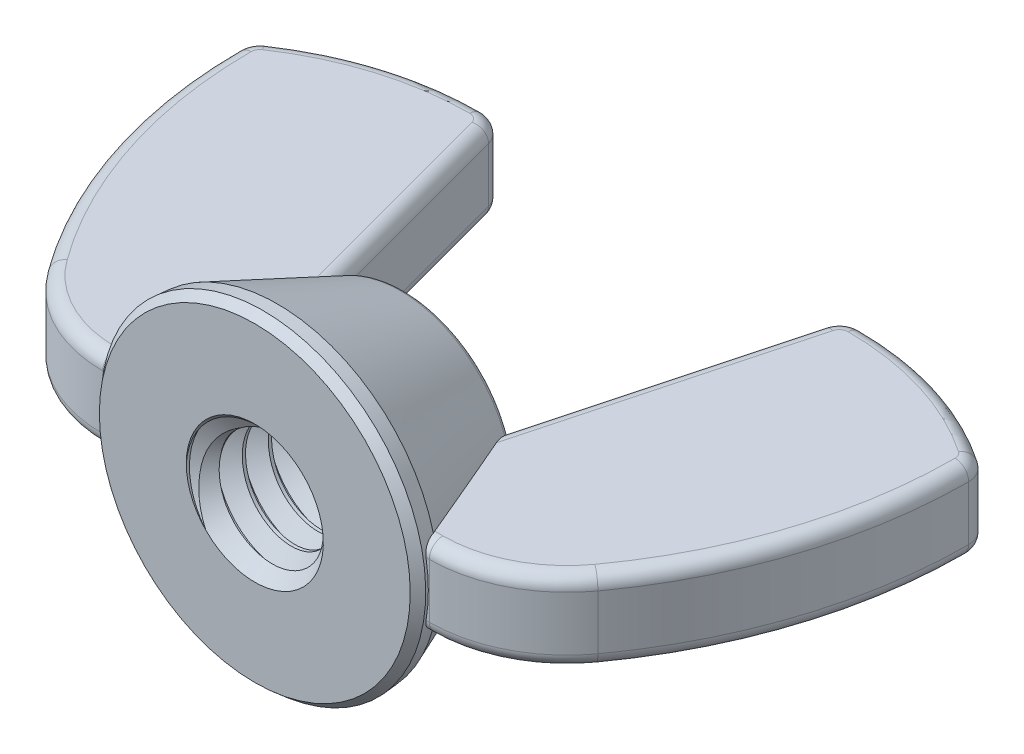
from build123d import *

# Parameters (mm, degrees)
EXTRUDE2_DEPTH     = 1.240234375
SKETCH3_R          = 4.9609375
EXTRUDE1_DEPTH     = 0.6858
EXTRUDE1_DRAFT     = -5
SKETCH15_R         = 4.900937775
EXTRUDE3_DEPTH     = 3.8862
EXTRUDE3_TAPER     = 22.116049887
FILLET3_R          = 0.254
SKETCH4_R          = 2.0828
CUT_EXTRUDE1_DEPTH = 18.58944448
SWEEP1_PITCH       = 0.79375
SKETCH7_R          = 4.9609375
CUT_EXTRUDE2_DEPTH = 18.589444509
SKETCH8_R          = 4.900937775
CUT_EXTRUDE3_DEPTH = 15.634307026
SKETCH11_R         = 2.032
CUT_EXTRUDE5_DEPTH = 15.634306992
CUT_EXTRUDE5_TAPER = 45
CHAMFER1_SIZE      = 0.257175
CHAMFER1_SIZE2     = 0.237388559
FILLET4_R          = 0.413411458


with BuildPart() as part:
    # Sketch13 → Extrude2 (new, symmetric)
    with BuildSketch(Plane(origin=(0, 0, 0), x_dir=(1, 0, 0), z_dir=(0, 1, 0))):
        with BuildLine():
            Line((3.043482358, 0.3429), (4.9609375, 0.3429))
            ThreePointArc((4.9609375, 0.3429), (6.865108063, 0.80061602), (8.353223522, 2.073754611))
            ThreePointArc((8.353223522, 2.073754611), (10.405439122, 6.109849745), (11.1125, 10.582177742))
            ThreePointArc((11.1125, 10.582177742), (11.031848656, 10.905652614), (10.808775492, 11.153400462))
            ThreePointArc((10.808775492, 11.153400462), (8.394996342, 12.304714058), (5.750076343, 12.7))
            ThreePointArc((5.750076343, 12.7), (5.330628092, 12.557616505), (5.084535002, 12.189312168))
            Line((5.084535002, 12.189312168), (3.043482358, 4.572))
            Line((3.043482358, 4.572), (3.043482358, 0.3429))
        make_face()
    extrude(amount=EXTRUDE2_DEPTH, both=True)

    # Fillet4
    fillet4_edges = [part.edges().sort_by_distance(p)[0] for p in [
        (6.865108063, 1.240234375, -0.80061602),
        (4.002209929, -1.240234375, -0.3429),
        (10.405439122, 1.240234375, -6.109849745),
        (11.031848656, 1.240234375, -10.905652614),
        (8.394996342, 1.240234375, -12.304714058),
        (5.330628092, 1.240234375, -12.557616505),
        (4.06400868, 1.240234375, -8.380656084),
        (4.002209929, 1.240234375, -0.3429),
        (4.06400868, -1.240234375, -8.380656084),
        (5.330628092, -1.240234375, -12.557616505),
        (8.394996342, -1.240234375, -12.304714058),
        (11.031848656, -1.240234375, -10.905652614),
        (10.405439122, -1.240234375, -6.109849745),
        (6.865108063, -1.240234375, -0.80061602),
    ]]
    fillet(fillet4_edges, radius=FILLET4_R)


with BuildPart() as body_2:
    # Sketch3 → Extrude1 (with draft: the straight prism first)
    with BuildSketch(Plane.XY):
        Circle(SKETCH3_R)
    extrude(amount=-EXTRUDE1_DEPTH)
    # Extrude1: the draft: its side faces are tilted about the plane it starts from
    extrude1_sides = [body_2.faces().sort_by_distance(p)[0] for p in [
        (-4.9609375, 0, -0.3429),
    ]]
    draft(extrude1_sides, Plane.XY, EXTRUDE1_DRAFT)

    # Sketch15 → Extrude3 (add)
    with BuildSketch(Plane(origin=(0, 0, -0.6858), x_dir=(-1, 0, 0), z_dir=(0, 0, -1))):
        Circle(SKETCH15_R)
    extrude(amount=EXTRUDE3_DEPTH, taper=EXTRUDE3_TAPER)

    # Fillet3
    fillet3_edges = [body_2.edges().sort_by_distance(p)[0] for p in [
        (3.321647339, 0, -4.572),
    ]]
    fillet(fillet3_edges, radius=FILLET3_R)

    # Sketch4 → Cut-Extrude1 (cut, through all)
    with BuildSketch(Plane.XY):
        Circle(SKETCH4_R)
    extrude(amount=-CUT_EXTRUDE1_DEPTH, mode=Mode.SUBTRACT)

    # Sweep1: the profile of Sketch6 profile screwed along a right-hand helix of 9.76 turns, 6 arcs to a turn; built about Z, then put on its axis
    sweep1_z = Axis((0, 0, 0), (0, 0, 1))
    sweep1_corners = [(2.0831, 0, -0.694704455), (1.567244252, 0, -0.396875), (1.567244252, 0, -0.29765625), (2.0831, 0, 0.000173205)]
    with BuildLine(mode=Mode.PRIVATE) as sweep1_profile:
        Line(sweep1_corners[0], sweep1_corners[1])
        Line(sweep1_corners[1], sweep1_corners[2])
        Line(sweep1_corners[2], sweep1_corners[3])
        Line(sweep1_corners[3], sweep1_corners[0])
    sweep1_cap = Face(sweep1_profile.wire())
    sweep1_turn_angles = [0, 30, 60, 90, 120, 150, 180, 210, 240, 270, 300, 330, 360]
    sweep1_turn_weights = [1, 0.8660254037844387, 1, 0.8660254037844387, 1, 0.8660254037844387, 1, 0.8660254037844387, 1, 0.8660254037844387, 1, 0.8660254037844387, 1]
    sweep1_turn_rails = [Edge.make_bspline([Vector(p[0], p[1], 0).rotate(sweep1_z, sweep1_turn_angles[k]) / sweep1_turn_weights[k] + Vector(0, 0, p[2] + SWEEP1_PITCH * sweep1_turn_angles[k] / 360) for k in range(13)], [0, 0, 0, 1, 1, 2, 2, 3, 3, 4, 4, 5, 5, 6, 6, 6], 2, sweep1_turn_weights) for p in sweep1_corners]
    sweep1_turn_sides = [Face.make_surface_from_curves(sweep1_turn_rails[p[0]], sweep1_turn_rails[p[1]]) for p in [(0, 1), (1, 2), (2, 3), (3, 0)]]
    sweep1_turn = Solid(Shell([*sweep1_turn_sides, sweep1_cap, sweep1_cap.rotate(sweep1_z, 360).moved(Location((0, 0, SWEEP1_PITCH * 360 / 360)))]))
    sweep1_last_angles = [3240, 3270, 3300, 3330, 3360, 3390, 3420, 3450, 3480, 3496.8, 3513.6]
    sweep1_last_weights = [1, 0.8660254037844387, 1, 0.8660254037844387, 1, 0.8660254037844387, 1, 0.8660254037844387, 1, 0.9573194975320675, 1]
    sweep1_last_rails = [Edge.make_bspline([Vector(p[0], p[1], 0).rotate(sweep1_z, sweep1_last_angles[k]) / sweep1_last_weights[k] + Vector(0, 0, p[2] + SWEEP1_PITCH * sweep1_last_angles[k] / 360) for k in range(11)], [0, 0, 0, 1, 1, 2, 2, 3, 3, 4, 4, 5, 5, 5], 2, sweep1_last_weights) for p in sweep1_corners]
    sweep1_last_sides = [Face.make_surface_from_curves(sweep1_last_rails[p[0]], sweep1_last_rails[p[1]]) for p in [(0, 1), (1, 2), (2, 3), (3, 0)]]
    sweep1_last = Solid(Shell([*sweep1_last_sides, sweep1_cap.rotate(sweep1_z, 3240).moved(Location((0, 0, SWEEP1_PITCH * 3240 / 360))), sweep1_cap.rotate(sweep1_z, 3513.6).moved(Location((0, 0, SWEEP1_PITCH * 3513.6 / 360)))]))
    sweep1_each = [*[sweep1_turn.moved(Location((0, 0, SWEEP1_PITCH * i))) for i in range(9)], sweep1_last]
    add(Plane(origin=(0, 0, 0), x_dir=(-1, 0, 0), z_dir=(0, 0, -1)) * Compound([sweep1_each[i] for i in range(0, 10, 2)]))
    add(Plane(origin=(0, 0, 0), x_dir=(-1, 0, 0), z_dir=(0, 0, -1)) * Compound([sweep1_each[i] for i in range(1, 10, 2)]))

    # Sketch7 → Cut-Extrude2 (cut, through all)
    with BuildSketch(Plane.XY):
        Circle(SKETCH7_R)
    extrude(amount=CUT_EXTRUDE2_DEPTH, mode=Mode.SUBTRACT)

    # Sketch8 → Cut-Extrude3 (cut, through all)
    with BuildSketch(Plane.XY.offset(-4.572)):
        Circle(SKETCH8_R)
    extrude(amount=-CUT_EXTRUDE3_DEPTH, mode=Mode.SUBTRACT)

    # Cut-Extrude4 cone 1 section (through the dimple's axis) → Cut-Extrude4 (revolve, cut)
    with BuildSketch(Plane(origin=(0, 0, 0), x_dir=(0, -1, 0), z_dir=(1, 0, 0))):
        Polygon((0, 0), (2.0828, 0), (0, 2.0828), align=None)
    revolve(axis=Axis((0, 0, 0), (0, 0, -1)), mode=Mode.SUBTRACT)

    # Sketch11 → Cut-Extrude5 (cut, through all)
    with BuildSketch(Plane.XY.offset(-4.572)):
        Circle(SKETCH11_R)
    extrude(amount=CUT_EXTRUDE5_DEPTH, taper=CUT_EXTRUDE5_TAPER, mode=Mode.SUBTRACT)

    # Chamfer1
    chamfer1_edges = [body_2.edges().sort_by_distance(p)[0] for p in [
        (-4.9609375, 0, 0),
    ]]
    chamfer1_side = [body_2.faces().sort_by_distance(p)[0] for p in [
        (-4.930937637, 0, -0.3429),
    ]]
    chamfer(chamfer1_edges, length=CHAMFER1_SIZE, length2=CHAMFER1_SIZE2, reference=chamfer1_side[0])


with BuildPart() as body_3:
    # Mirror6: mirrored copy
    add(part.part.mirror(Plane(origin=(0, 0, 0), x_dir=(0, 0, 1), z_dir=(1, 0, 0))))

    # Combine2: union part, body 2
    add(part.part)
    add(body_2.part)


solid = body_3.part
